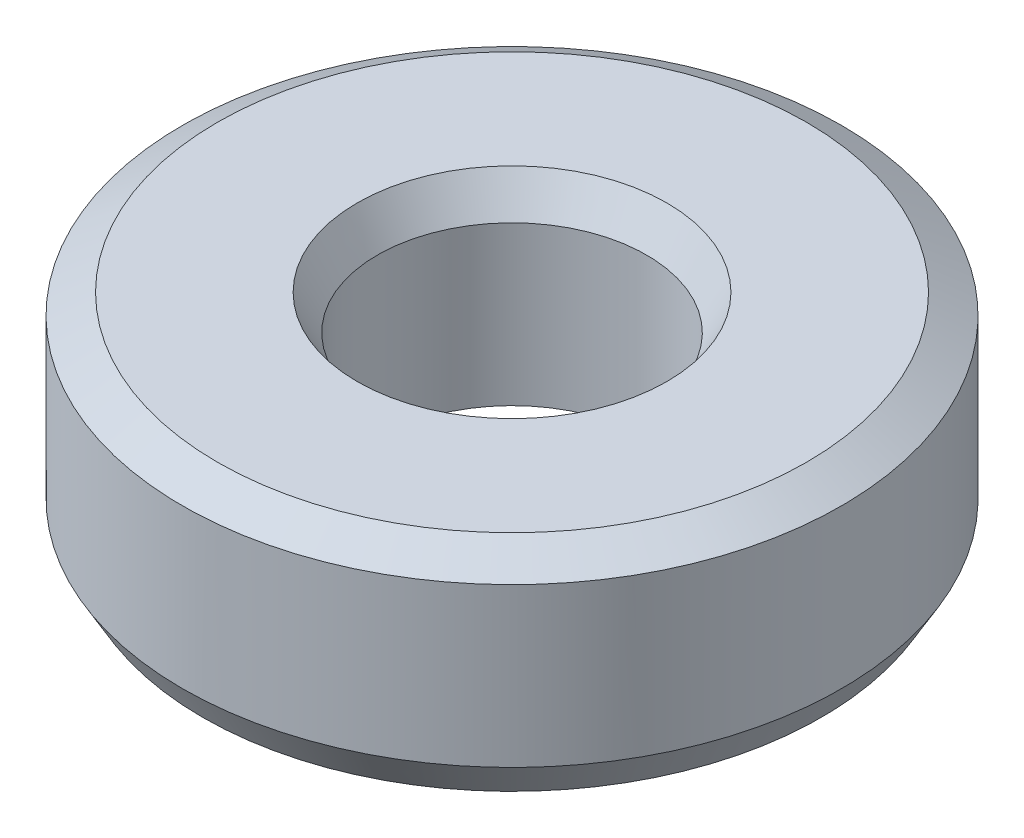
from build123d import *
from OCP.BRepFilletAPI import BRepFilletAPI_MakeChamfer

# Parameters (mm, degrees)
SKETCH1_R           = 52.5
BOSS_EXTRUDE1_DEPTH = 34.024959688
SKETCH2_R           = 21.442359695
CUT_EXTRUDE1_DEPTH  = 82.671279418
CHAMFER1_SIZE       = 3.22159549
CHAMFER1_SIZE2      = 5.57996707


with BuildPart() as part:
    # Sketch1 → Boss-Extrude1 (new body)
    with BuildSketch(Plane(origin=(0, 0, 0), x_dir=(1, 0, 0), z_dir=(0, 1, 0))):
        Circle(SKETCH1_R)
    extrude(amount=BOSS_EXTRUDE1_DEPTH)

    # Sketch2 → Cut-Extrude1 (cut, through all)
    with BuildSketch(Plane(origin=(0, 0, 0), x_dir=(1, 0, 0), z_dir=(0, 1, 0))):
        Circle(SKETCH2_R)
    extrude(amount=CUT_EXTRUDE1_DEPTH, mode=Mode.SUBTRACT)

    # Chamfer1: one chamfer whose edges measure the first distance from different faces: ONE call of the kernel's chamfer builder (chamfer() names one face for all edges)
    chamfer1_edges_1 = [part.edges().sort_by_distance(p)[0] for p in [
        (-21.442359695, 34.024959688, 0),
    ]]
    chamfer1_side_1 = [part.faces().sort_by_distance(p)[0] for p in [
        (-51.01507576, 34.024959688, 0),
    ]]
    chamfer1_edges_2 = [part.edges().sort_by_distance(p)[0] for p in [
        (-21.442359695, 0, 0),
    ]]
    chamfer1_side_2 = [part.faces().sort_by_distance(p)[0] for p in [
        (-21.442359695, 17.012479844, 0),
    ]]
    chamfer1_edges_3 = [part.edges().sort_by_distance(p)[0] for p in [
        (-52.5, 0, 0),
    ]]
    chamfer1_side_3 = [part.faces().sort_by_distance(p)[0] for p in [
        (-51.01507576, 0, 0),
    ]]
    chamfer1_edges_4 = [part.edges().sort_by_distance(p)[0] for p in [
        (-52.5, 34.024959688, 0),
    ]]
    chamfer1_side_4 = [part.faces().sort_by_distance(p)[0] for p in [
        (-52.5, 17.012479844, 0),
    ]]
    chamfer1 = BRepFilletAPI_MakeChamfer(part.part.solid().wrapped)
    for e in chamfer1_edges_1:
        chamfer1.Add(CHAMFER1_SIZE, CHAMFER1_SIZE2, e.wrapped, chamfer1_side_1[0].wrapped)  # the first distance lies on this face
    for e in chamfer1_edges_2:
        chamfer1.Add(CHAMFER1_SIZE, CHAMFER1_SIZE2, e.wrapped, chamfer1_side_2[0].wrapped)  # the first distance lies on this face
    for e in chamfer1_edges_3:
        chamfer1.Add(CHAMFER1_SIZE, CHAMFER1_SIZE2, e.wrapped, chamfer1_side_3[0].wrapped)  # the first distance lies on this face
    for e in chamfer1_edges_4:
        chamfer1.Add(CHAMFER1_SIZE, CHAMFER1_SIZE2, e.wrapped, chamfer1_side_4[0].wrapped)  # the first distance lies on this face
    add(Compound.cast(chamfer1.Shape()), mode=Mode.REPLACE)


solid = part.part
